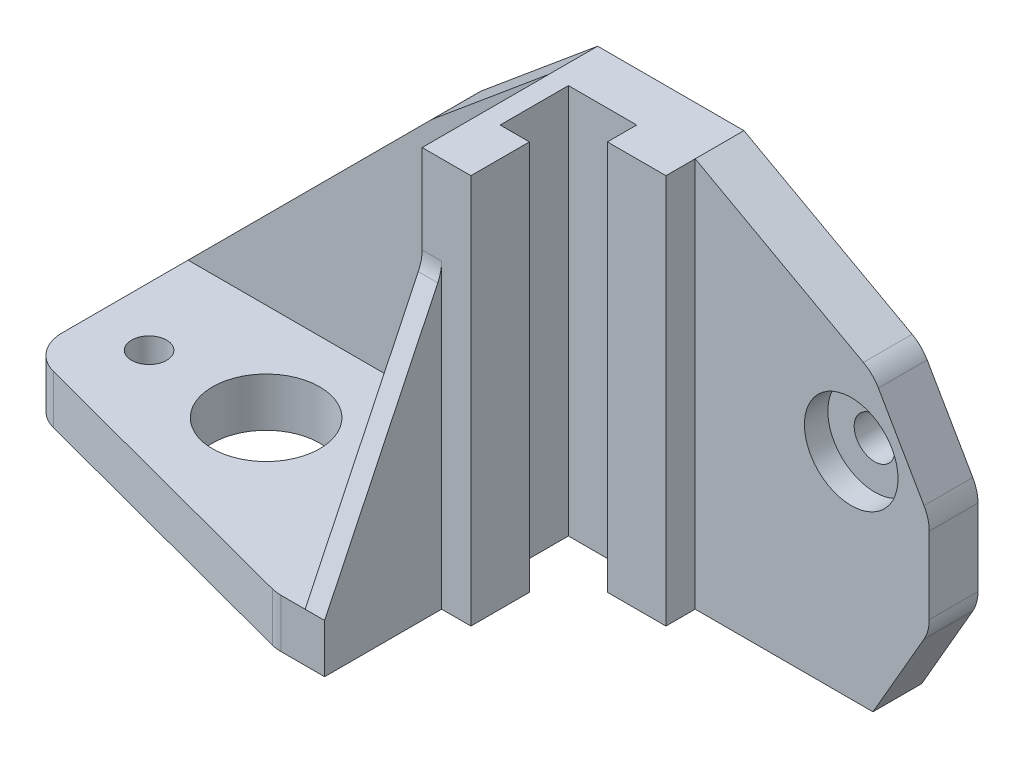
from build123d import *

# Parameters (mm, degrees)
SKETCH1_W                     = 30
SKETCH1_H                     = 30
BOSS_EXTRUDE1_DEPTH           = 30
SKETCH2_W                     = 20
SKETCH2_H                     = 20
CUT_EXTRUDE1_DEPTH            = 37.742346142
SKETCH3_W                     = 30
SKETCH3_H                     = 5
BOSS_EXTRUDE2_DEPTH           = 40
SKETCH4_R                     = 5.5
SKETCH4_R_2                   = 1.8
CUT_EXTRUDE2_DEPTH            = 65.420493634
CUT_EXTRUDE3_DEPTH            = 63.24949799
SKETCH5_W                     = 5
SKETCH5_H                     = 25
BOSS_EXTRUDE4_DEPTH           = 34
CHAMFER1_SIZE                 = 25
SKETCH8_R                     = 2.1
CUT_EXTRUDE4_DEPTH            = 63.657800791
SKETCH9_W                     = 5
SKETCH9_H                     = 30
BOSS_EXTRUDE5_DEPTH           = 12
CHAMFER2_SIZE                 = 10
CHAMFER2_SIZE2                = 5.773502692
SKETCH10_R                    = 2.1
CUT_EXTRUDE5_DEPTH            = 63.657800791
BODY_MOVE_COPY1_START         = -15
BODY_MOVE_COPY1_DEPTH         = 31
BODY_MOVE_COPY1_START_2       = -10
BODY_MOVE_COPY1_2_DEPTH       = 26
BODY_MOVE_COPY1_3_OUTLINE_W   = 34
BODY_MOVE_COPY1_3_OUTLINE_H   = 5
BODY_MOVE_COPY1_3_DEPTH       = 30
BODY_MOVE_COPY1_4_DEPTH       = 5
BODY_MOVE_COPY1_5_OUTLINE_R   = 5.5
BODY_MOVE_COPY1_5_OUTLINE_R_2 = 1.8
BODY_MOVE_COPY1_5_DEPTH       = 5
SKETCH11_W                    = 3
SKETCH11_H                    = 25
CUT_EXTRUDE6_DEPTH            = 25
SKETCH12_W                    = 25
SKETCH12_H                    = 25
CUT_EXTRUDE7_DEPTH            = 60.380131357
SKETCH13_W                    = 3
SKETCH13_H                    = 6
SKETCH13_W_2                  = 6
SKETCH13_H_2                  = 3
BOSS_EXTRUDE6_DEPTH           = 30
SKETCH14_R                    = 4.8
CUT_EXTRUDE9_DEPTH            = 2.4
CHAMFER3_SIZE                 = 12
CHAMFER3_SIZE2                = 25
FILLET1_R                     = 4
BOSS_EXTRUDE7_DEPTH           = 10
BOSS_EXTRUDE8_DEPTH           = 5
FILLET3_R                     = 4
FILLET4_R                     = 4


with BuildPart() as part:
    # Sketch1 → Boss-Extrude1 (new body)
    with BuildSketch(Plane(origin=(0, 0, 0), x_dir=(1, 0, 0), z_dir=(0, 1, 0))):
        Rectangle(SKETCH1_W, SKETCH1_H)
    extrude(amount=BOSS_EXTRUDE1_DEPTH)

    # Sketch2 → Cut-Extrude1 (cut, through all)
    with BuildSketch(Plane(origin=(0, 30, 0), x_dir=(1, 0, 0), z_dir=(0, 1, 0))):
        Rectangle(SKETCH2_W, SKETCH2_H)
    extrude(amount=-CUT_EXTRUDE1_DEPTH, mode=Mode.SUBTRACT)

    # Sketch3 → Boss-Extrude2 (add)
    with BuildSketch(Plane(origin=(15, 0, 0), x_dir=(0, 0, -1), z_dir=(1, 0, 0))):
        with Locations((0, 2.5)):
            Rectangle(SKETCH3_W, SKETCH3_H)
    extrude(amount=BOSS_EXTRUDE2_DEPTH)

    # Sketch4 → Cut-Extrude2 (cut, through all)
    with BuildSketch(Plane.XZ):
        with Locations(Location((31, 0, 0), (0, 0, 270))):
            Circle(SKETCH4_R)
        with Locations(Location((19, 0, 0), (0, 0, 270))):
            Circle(SKETCH4_R_2)
        with Locations(Location((43, 0, 0), (0, 0, 270))):
            Circle(SKETCH4_R_2)
    extrude(amount=-CUT_EXTRUDE2_DEPTH, mode=Mode.SUBTRACT)

    # Sketch7 → Cut-Extrude3 (cut, through all)
    with BuildSketch(Plane(origin=(0, 5, 0), x_dir=(1, 0, 0), z_dir=(0, 1, 0))):
        Polygon((15, -15), (49, -6), (49, 15), (55, 15), (55, -15), align=None)
    extrude(amount=-CUT_EXTRUDE3_DEPTH, mode=Mode.SUBTRACT)

    # Sketch5 → Boss-Extrude4 (add)
    with BuildSketch(Plane(origin=(15, 0, 0), x_dir=(0, 0, -1), z_dir=(1, 0, 0))):
        with Locations((12.5, 17.5)):
            Rectangle(SKETCH5_W, SKETCH5_H)
    extrude(amount=BOSS_EXTRUDE4_DEPTH)

    # Chamfer1
    chamfer1_edges = [part.edges().sort_by_distance(p)[0] for p in [
        (49, 30, -12.5),
    ]]
    chamfer(chamfer1_edges, length=CHAMFER1_SIZE)

    # Sketch8 → Cut-Extrude4 (cut, through all)
    with BuildSketch(Plane.XY.offset(-10)):
        with Locations((20, 22)):
            Circle(SKETCH8_R)
    extrude(amount=-CUT_EXTRUDE4_DEPTH, mode=Mode.SUBTRACT)

    # Sketch9 → Boss-Extrude5 (add)
    with BuildSketch(Plane.ZY.offset(15)):
        with Locations((-12.5, 15)):
            Rectangle(SKETCH9_W, SKETCH9_H)
    extrude(amount=BOSS_EXTRUDE5_DEPTH)

    # Chamfer2
    chamfer2_edges = [part.edges().sort_by_distance(p)[0] for p in [
        (-27, 30, -12.5),
        (-27, 0, -12.5),
    ]]
    chamfer2_side = [part.faces().sort_by_distance(p)[0] for p in [
        (-27, 15, -12.5),
    ]]
    chamfer(chamfer2_edges, length=CHAMFER2_SIZE, length2=CHAMFER2_SIZE2, reference=chamfer2_side[0])

    # Sketch10 → Cut-Extrude5 (cut, through all)
    with BuildSketch(Plane.XY.offset(-10)):
        with Locations((-19, 22)):
            Circle(SKETCH10_R)
    extrude(amount=-CUT_EXTRUDE5_DEPTH, mode=Mode.SUBTRACT)

    # Body-Move/Copy1: read off the stored shape, not the designer's step
    # Body-Move/Copy1 outline → Body-Move/Copy1 (cut)
    with BuildSketch(Plane.XY.offset(BODY_MOVE_COPY1_START)):
        Polygon((24, 30), (21.226497308, 30), (27, 20), (27, 10), (21.226497308, 0), (49, 0), (49, 5), align=None)
        with BuildLine():
            ThreePointArc((-19.5, 19.960392195), (-21.1, 22), (-19.5, 24.039607805))
            ThreePointArc((-19.5, 24.039607805), (-22.1, 22), (-19.5, 19.960392195))
        make_face()
        with BuildLine():
            ThreePointArc((19.5, 19.960392195), (17.9, 22), (19.5, 24.039607805))
            ThreePointArc((19.5, 24.039607805), (16.9, 22), (19.5, 19.960392195))
        make_face()
    extrude(amount=BODY_MOVE_COPY1_DEPTH, mode=Mode.SUBTRACT)

    # Body-Move_Copy1 2 outline → Body-Move_Copy1 2 (cut)
    with BuildSketch(Plane.XY.offset(BODY_MOVE_COPY1_START_2)):
        Polygon((24.113248654, 5), (15, 5), (15, 0), (21.226497308, 0), align=None)
    extrude(amount=BODY_MOVE_COPY1_2_DEPTH, mode=Mode.SUBTRACT)

    # Body-Move_Copy1 3 outline → Body-Move_Copy1 3 (add)
    with BuildSketch(Plane.XY.offset(BODY_MOVE_COPY1_START)):
        with Locations((-32, 2.5)):
            Rectangle(BODY_MOVE_COPY1_3_OUTLINE_W, BODY_MOVE_COPY1_3_OUTLINE_H)
    extrude(amount=BODY_MOVE_COPY1_3_DEPTH)

    # Body-Move_Copy1 4 outline → Body-Move_Copy1 4 (add)
    with BuildSketch(Plane.XY.offset(BODY_MOVE_COPY1_START)):
        Polygon((-27, 20), (-21.226497308, 30), (-24, 30), (-49, 5), (-24.113248654, 5), (-27, 10), align=None)
        with BuildLine():
            ThreePointArc((-19.5, 24.039607805), (-17.9, 22), (-19.5, 19.960392195))
            ThreePointArc((-19.5, 19.960392195), (-16.9, 22), (-19.5, 24.039607805))
        make_face()
        with BuildLine():
            ThreePointArc((19.5, 24.039607805), (21.1, 22), (19.5, 19.960392195))
            ThreePointArc((19.5, 19.960392195), (22.1, 22), (19.5, 24.039607805))
        make_face()
    extrude(amount=BODY_MOVE_COPY1_4_DEPTH)

    # Body-Move_Copy1 5 outline → Body-Move_Copy1 5 (cut)
    with BuildSketch(Plane(origin=(0, 0, 0), x_dir=(1, 0, 0), z_dir=(0, 1, 0))):
        with Locations((-31, 0)):
            Circle(BODY_MOVE_COPY1_5_OUTLINE_R)
        with Locations((-19, 0)):
            Circle(BODY_MOVE_COPY1_5_OUTLINE_R_2)
        with Locations((-43, 0)):
            Circle(BODY_MOVE_COPY1_5_OUTLINE_R_2)
        Polygon((-49, -15), (-15, -15), (-49, -6), align=None)
    extrude(amount=BODY_MOVE_COPY1_5_DEPTH, mode=Mode.SUBTRACT)

    # Sketch11 → Cut-Extrude6 (cut)
    with BuildSketch(Plane(origin=(0, 30, 0), x_dir=(1, 0, 0), z_dir=(0, 1, 0))):
        with Locations((-13.5, -2.5)):
            Rectangle(SKETCH11_W, SKETCH11_H)
    extrude(amount=-CUT_EXTRUDE6_DEPTH, mode=Mode.SUBTRACT)

    # Sketch12 → Cut-Extrude7 (cut, through all)
    with BuildSketch(Plane(origin=(0, 30, 0), x_dir=(1, 0, 0), z_dir=(0, 1, 0))):
        with Locations((2.5, -2.5)):
            Rectangle(SKETCH12_W, SKETCH12_H)
    extrude(amount=-CUT_EXTRUDE7_DEPTH, mode=Mode.SUBTRACT)

    # Sketch13 → Boss-Extrude6 (add)
    with BuildSketch(Plane(origin=(0, 30, 0), x_dir=(1, 0, 0), z_dir=(0, 1, 0))):
        with Locations((-8.5, 0)):
            Rectangle(SKETCH13_W, SKETCH13_H)
        with Locations((0, 8.5)):
            Rectangle(SKETCH13_W_2, SKETCH13_H_2)
    extrude(amount=-BOSS_EXTRUDE6_DEPTH)

    # Sketch14 → Cut-Extrude9 (cut)
    with BuildSketch(Plane.XY.offset(-10)):
        with Locations((-20, 22)):
            Circle(SKETCH14_R)
        with Locations((19, 22)):
            Circle(SKETCH14_R)
    extrude(amount=-CUT_EXTRUDE9_DEPTH, mode=Mode.SUBTRACT)

    # Chamfer3
    chamfer3_edges = [part.edges().sort_by_distance(p)[0] for p in [
        (-11, 30, 15),
    ]]
    chamfer3_side = [part.faces().sort_by_distance(p)[0] for p in [
        (-18, 30, -10.542718717),
    ]]
    chamfer(chamfer3_edges, length=CHAMFER3_SIZE, length2=CHAMFER3_SIZE2, reference=chamfer3_side[0])

    # Fillet1
    fillet1_edges = [part.edges().sort_by_distance(p)[0] for p in [
        (-49, 2.5, 6),
        (-15, 2.5, 15),
    ]]
    fillet(fillet1_edges, radius=FILLET1_R)

    # Sketch16 → Boss-Extrude7 (add)
    with BuildSketch(Plane(origin=(0, 30, 0), x_dir=(1, 0, 0), z_dir=(0, 1, 0))):
        Polygon((-12, -3), (-7, -3), (-7, 3), (-10, 3), (-10, 10), (-3, 10), (-3, 7), (3, 7), (3, 15), (-12, 15), align=None)
    extrude(amount=BOSS_EXTRUDE7_DEPTH)

    # Sketch17 → Boss-Extrude8 (add)
    with BuildSketch(Plane(origin=(0, 0, -15), x_dir=(-1, 0, 0), z_dir=(0, 0, -1))):
        Polygon((-21.226497308, 30), (-3, 40), (-3, 30), align=None)
        Polygon((12, 30), (12, 40), (24, 30), align=None)
    extrude(amount=-BOSS_EXTRUDE8_DEPTH)

    # Fillet3
    fillet3_edges = [part.edges().sort_by_distance(p)[0] for p in [
        (-11, 30, 3),
    ]]
    fillet(fillet3_edges, radius=FILLET3_R)

    # Fillet4
    # the kernel refuses this fillet: 4 mm, written as the material it takes off along each edge
    with BuildSketch(Plane(origin=(27, 10, -17.679491924), x_dir=(-0.500000000006737, -0.8660254037805489, 0), z_dir=(0, 0, 1))) as fillet4_piece_1:
        with BuildLine():
            CenterArc((FILLET4_R * 0.267949192435, -FILLET4_R), FILLET4_R, 90, 30)
            Line((-FILLET4_R * 0.232050807571, -FILLET4_R * 0.133974596219), (0, 0))
            Line((0, 0), (FILLET4_R * 0.267949192435, 0))
        make_face()
    extrude(amount=10.358983849, mode=Mode.SUBTRACT)
    with BuildSketch(Plane(origin=(27, 20, -17.679491924), x_dir=(-0.5000000000067392, 0.8660254037805477, 0), z_dir=(0, 0, 1))) as fillet4_piece_2:
        with BuildLine():
            CenterArc((FILLET4_R * 0.267949192435, FILLET4_R), FILLET4_R, 240, 30)
            Line((-FILLET4_R * 0.232050807571, FILLET4_R * 0.133974596219), (0, 0))
            Line((0, 0), (FILLET4_R * 0.267949192435, 0))
        make_face()
    extrude(amount=10.358983849, mode=Mode.SUBTRACT)
    with BuildSketch(Plane(origin=(21.226497308, 30, -17.796617535), x_dir=(0.5000000000067387, -0.8660254037805479, 0), z_dir=(0, 0, 1))) as fillet4_piece_3:
        with BuildLine():
            CenterArc((FILLET4_R * 0.27966175346, -FILLET4_R), FILLET4_R, 90, 31.248547441)
            Line((-FILLET4_R * 0.23908983086, -FILLET4_R * 0.145074977694), (0, 0))
            Line((0, 0), (FILLET4_R * 0.27966175346, 0))
        make_face()
    extrude(amount=10.59323507, mode=Mode.SUBTRACT)
    with BuildSketch(Plane(origin=(-24, 30, -15.453610172), x_dir=(0.7682212795973823, 0.6401843996644723, 0), z_dir=(0, 0, 1))) as fillet4_piece_4:
        with BuildLine():
            CenterArc((FILLET4_R * 0.0453610171873, -FILLET4_R), FILLET4_R, 90, 5.194428908)
            Line((-FILLET4_R * 0.0451747288553, -FILLET4_R * 0.0041067935323), (0, 0))
            Line((0, 0), (FILLET4_R * 0.0453610171873, 0))
        make_face()
    extrude(amount=5.907220344, mode=Mode.SUBTRACT)


solid = part.part
